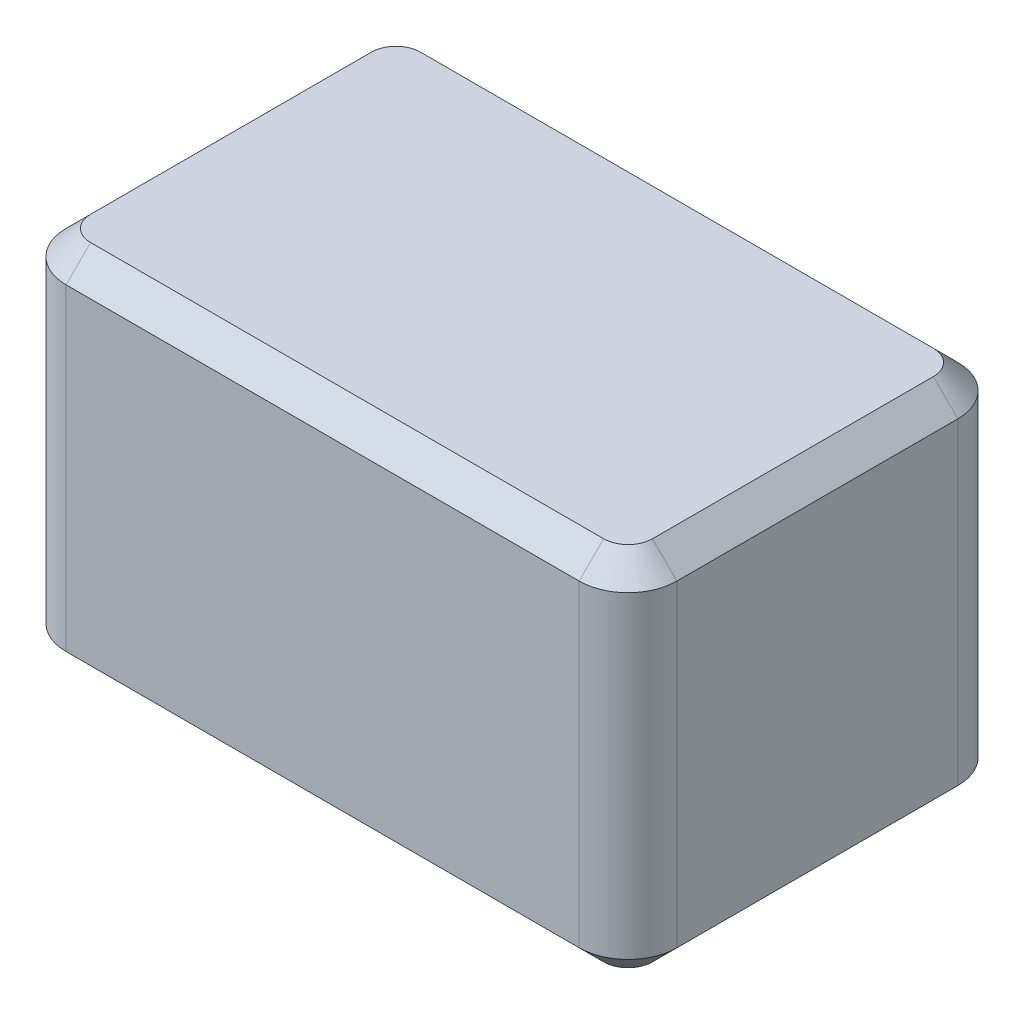
from build123d import *

# Parameters (mm, degrees)
SKETCH1_W           = 25
SKETCH1_H           = 15.5
BOSS_EXTRUDE1_DEPTH = 15
FILLET1_R           = 2
CHAMFER1_SIZE       = 1


with BuildPart() as part:
    # Sketch1 → Boss-Extrude1 (new body)
    with BuildSketch(Plane(origin=(0, 0, 0), x_dir=(1, 0, 0), z_dir=(0, 1, 0))):
        with Locations((12.5, 8.590078954)):
            Rectangle(SKETCH1_W, SKETCH1_H)
    extrude(amount=BOSS_EXTRUDE1_DEPTH)

    # Fillet1
    fillet1_edges = [part.edges().sort_by_distance(p)[0] for p in [
        (25, 7.5, -0.840078954),
        (25, 7.5, -16.340078954),
        (0, 7.5, -16.340078954),
        (0, 7.5, -0.840078954),
    ]]
    fillet(fillet1_edges, radius=FILLET1_R)

    # Chamfer1
    chamfer1_edges = [part.edges().sort_by_distance(p)[0] for p in [
        (12.5, 15, -16.340078954),
        (0.585786438, 15, -15.754292517),
        (24.414213562, 15, -15.754292517),
        (0, 15, -8.590078954),
        (25, 15, -8.590078954),
        (0.585786438, 15, -1.425865392),
        (24.414213562, 15, -1.425865392),
        (12.5, 15, -0.840078954),
        (12.5, 0, -16.340078954),
        (0.585786438, 0, -15.754292517),
        (24.414213562, 0, -15.754292517),
        (0, 0, -8.590078954),
        (25, 0, -8.590078954),
        (0.585786438, 0, -1.425865392),
        (24.414213562, 0, -1.425865392),
        (12.5, 0, -0.840078954),
    ]]
    chamfer(chamfer1_edges, length=CHAMFER1_SIZE)


solid = part.part
